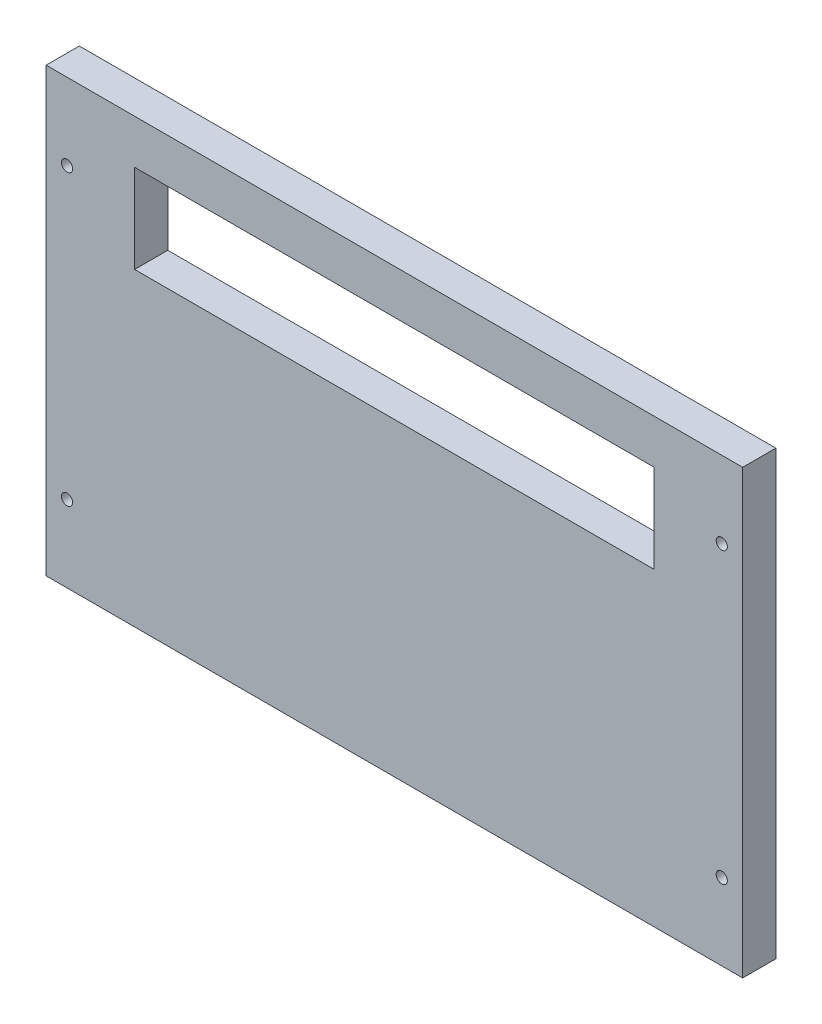
from build123d import *

# Parameters (mm, degrees)
SKETCH1_W                = 200
SKETCH1_H                = 127
SKETCH1_R                = 1.6
WALL_DEPTH               = 9.525
CANNULALARGECUTOUT_REACH = 239.107
SKETCH3_W                = 149.2
SKETCH3_H                = 25.4


with BuildPart() as part:
    # Sketch1 → Wall (new body)
    with BuildSketch(Plane.XY):
        with Locations((100, 63.5)):
            Rectangle(SKETCH1_W, SKETCH1_H)
        with Locations((6, 105)):
            Circle(SKETCH1_R, mode=Mode.SUBTRACT)
        with Locations((6, 22)):
            Circle(SKETCH1_R, mode=Mode.SUBTRACT)
        with Locations((194, 22)):
            Circle(SKETCH1_R, mode=Mode.SUBTRACT)
        with Locations((194, 105)):
            Circle(SKETCH1_R, mode=Mode.SUBTRACT)
    extrude(amount=WALL_DEPTH)

    # Sketch3 → CannulaLargeCutout (cut, up to next)
    with BuildSketch(Plane.XY.offset(9.525), mode=Mode.PRIVATE) as cannulalargecutout_sk1:
        with Locations((100, 101.6)):
            Rectangle(SKETCH3_W, SKETCH3_H)
    cannulalargecutout_tool1 = extrude(cannulalargecutout_sk1.sketch, amount=-CANNULALARGECUTOUT_REACH, mode=Mode.PRIVATE) & part.part
    add(cannulalargecutout_tool1.solids().sort_by_distance((100, 101.6, 9.525))[0], mode=Mode.SUBTRACT)


solid = part.part
